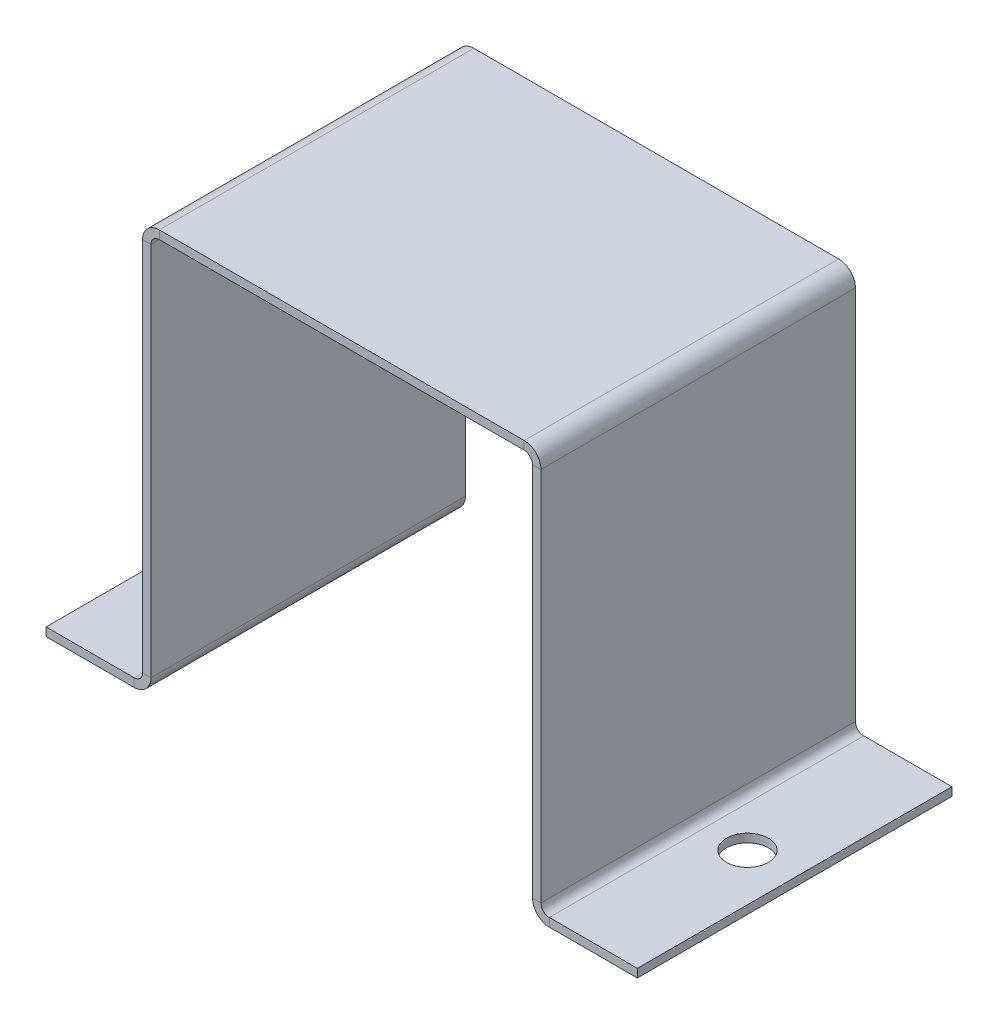
from build123d import *

# Parameters (mm, degrees)
SKETCH1_W                      = 38
SKETCH1_H                      = 30
BASE_FLANGE1_DEPTH             = 0.8
EDGE_FLANGE1_STRIP_W           = 4.8
EDGE_FLANGE1_STRIP_H           = 0.8
EDGE_FLANGE1_STRIP_CUT_DEPTH   = 30
EDGE_FLANGE1_STRIP_2_W         = 4.8
EDGE_FLANGE1_STRIP_2_H         = 0.8
EDGE_FLANGE1_STRIP_CUT_2_DEPTH = 30
EDGE_FLANGE1_DEPTH             = 30
EDGE_FLANGE1_BEND_DEPTH        = 30
EDGE_FLANGE2_STRIP_W           = 4.8
EDGE_FLANGE2_STRIP_H           = 0.8
EDGE_FLANGE2_STRIP_CUT_DEPTH   = 30
EDGE_FLANGE2_STRIP_2_W         = 4.8
EDGE_FLANGE2_STRIP_2_H         = 0.8
EDGE_FLANGE2_STRIP_CUT_2_DEPTH = 30
EDGE_FLANGE2_DEPTH             = 30
EDGE_FLANGE2_BEND_DEPTH        = 30
SKETCH15_R                     = 2
CUT_EXTRUDE1_DEPTH             = 10


# Sheet-metal steps are written as plain solids
with BuildPart() as part:
    # Sketch1 → Base-Flange1 (new body)
    with BuildSketch(Plane(origin=(0, 0, 0), x_dir=(1, 0, 0), z_dir=(0, 1, 0))):
        Rectangle(SKETCH1_W, SKETCH1_H)
    extrude(amount=-BASE_FLANGE1_DEPTH)

    # Edge-Flange1 strip (across the edge) → Edge-Flange1 strip cut (cut)
    with BuildSketch(Plane(origin=(-19, -0.8, 15), x_dir=(1, 0, 0), z_dir=(0, 0, -1))):
        with Locations((-0.8, -0.4)):
            Rectangle(EDGE_FLANGE1_STRIP_W, EDGE_FLANGE1_STRIP_H)
    extrude(amount=EDGE_FLANGE1_STRIP_CUT_DEPTH, mode=Mode.SUBTRACT)

    # Edge-Flange1 strip 2 (across the edge) → Edge-Flange1 strip cut 2 (cut)
    with BuildSketch(Plane(origin=(19, -0.8, -15), x_dir=(-1, 0, 0), z_dir=(0, 0, 1))):
        with Locations((-0.8, -0.4)):
            Rectangle(EDGE_FLANGE1_STRIP_2_W, EDGE_FLANGE1_STRIP_2_H)
    extrude(amount=EDGE_FLANGE1_STRIP_CUT_2_DEPTH, mode=Mode.SUBTRACT)

    # Edge-Flange1 section (across the edge) → Edge-Flange1 (add)
    with BuildSketch(Plane(origin=(-19, -0.8, 15), x_dir=(1, 0, 0), z_dir=(0, 0, -1))):
        with BuildLine():
            Line((0, 0.8), (0, 38.2))
            Line((0, 38.2), (0.8, 38.2))
            Line((0.8, 38.2), (0.8, 0.8))
            ThreePointArc((0.8, 0.8), (1.034314575, 0.234314575), (1.6, 0))
            Line((1.6, 0), (1.6, -0.8))
            ThreePointArc((1.6, -0.8), (0.46862915, -0.33137085), (0, 0.8))
        make_face()
    extrude(amount=EDGE_FLANGE1_DEPTH)

    # Edge-Flange1 section 2 (across the edge) → Edge-Flange1 bend (add)
    with BuildSketch(Plane(origin=(19, -0.8, -15), x_dir=(-1, 0, 0), z_dir=(0, 0, 1))):
        with BuildLine():
            Line((0, 0.8), (0, 38.2))
            Line((0, 38.2), (0.8, 38.2))
            Line((0.8, 38.2), (0.8, 0.8))
            ThreePointArc((0.8, 0.8), (1.034314575, 0.234314575), (1.6, 0))
            Line((1.6, 0), (1.6, -0.8))
            ThreePointArc((1.6, -0.8), (0.46862915, -0.33137085), (0, 0.8))
        make_face()
    extrude(amount=EDGE_FLANGE1_BEND_DEPTH)

    # Edge-Flange2 strip (across the edge) → Edge-Flange2 strip cut (cut)
    with BuildSketch(Plane(origin=(-19, -39, -15), x_dir=(0, 1, 0), z_dir=(0, 0, 1))):
        with Locations((-0.8, -0.4)):
            Rectangle(EDGE_FLANGE2_STRIP_W, EDGE_FLANGE2_STRIP_H)
    extrude(amount=EDGE_FLANGE2_STRIP_CUT_DEPTH, mode=Mode.SUBTRACT)

    # Edge-Flange2 strip 2 (across the edge) → Edge-Flange2 strip cut 2 (cut)
    with BuildSketch(Plane(origin=(19, -39, 15), x_dir=(0, 1, 0), z_dir=(0, 0, -1))):
        with Locations((-0.8, -0.4)):
            Rectangle(EDGE_FLANGE2_STRIP_2_W, EDGE_FLANGE2_STRIP_2_H)
    extrude(amount=EDGE_FLANGE2_STRIP_CUT_2_DEPTH, mode=Mode.SUBTRACT)

    # Edge-Flange2 section (across the edge) → Edge-Flange2 (add)
    with BuildSketch(Plane(origin=(-19, -39, -15), x_dir=(0, 1, 0), z_dir=(0, 0, 1))):
        with BuildLine():
            Line((0, 0.8), (0, 9.2))
            Line((0, 9.2), (0.8, 9.2))
            Line((0.8, 9.2), (0.8, 0.8))
            ThreePointArc((0.8, 0.8), (1.034314575, 0.234314575), (1.6, 0))
            Line((1.6, 0), (1.6, -0.8))
            ThreePointArc((1.6, -0.8), (0.46862915, -0.33137085), (0, 0.8))
        make_face()
    extrude(amount=EDGE_FLANGE2_DEPTH)

    # Edge-Flange2 section 2 (across the edge) → Edge-Flange2 bend (add)
    with BuildSketch(Plane(origin=(19, -39, 15), x_dir=(0, 1, 0), z_dir=(0, 0, -1))):
        with BuildLine():
            Line((0, 0.8), (0, 9.2))
            Line((0, 9.2), (0.8, 9.2))
            Line((0.8, 9.2), (0.8, 0.8))
            ThreePointArc((0.8, 0.8), (1.034314575, 0.234314575), (1.6, 0))
            Line((1.6, 0), (1.6, -0.8))
            ThreePointArc((1.6, -0.8), (0.46862915, -0.33137085), (0, 0.8))
        make_face()
    extrude(amount=EDGE_FLANGE2_BEND_DEPTH)

    # Sketch15 → Cut-Extrude1 (cut)
    with BuildSketch(Plane(origin=(0, -38.2, 0), x_dir=(1, 0, 0), z_dir=(0, 1, 0))):
        with Locations(Location((-23.7, 0, 0), (0, 0, 270))):
            Circle(SKETCH15_R)
        with Locations(Location((23.7, 0, 0), (0, 0, 270))):
            Circle(SKETCH15_R)
    extrude(amount=-CUT_EXTRUDE1_DEPTH, mode=Mode.SUBTRACT)


solid = part.part
